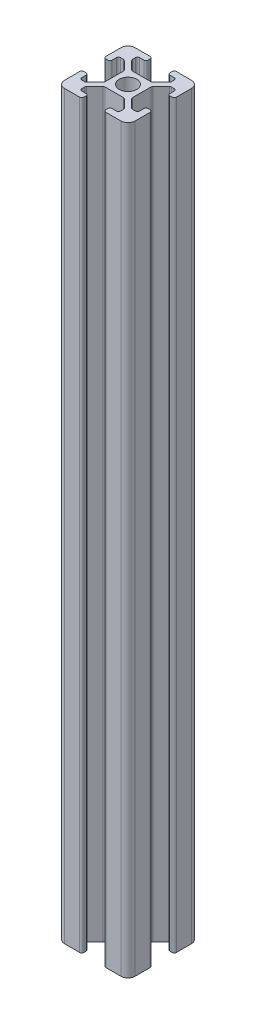
from build123d import *

# Parameters (mm, degrees)
SKETCH_1_R      = 2.5
EXTRUDE_1_DEPTH = 210


with BuildPart() as part:
    # 草图1 → 凸台-拉伸1 (new body)
    with BuildSketch(Plane(origin=(0, 0, 0), x_dir=(1, 0, 0), z_dir=(0, 1, 0))):
        with BuildLine():
            Line((3.1, 8.8), (3.1, 9.4))
            ThreePointArc((3.1, 9.4), (3.275735931, 9.824264069), (3.7, 10))
            Line((3.7, 10), (8, 10))
            ThreePointArc((8, 10), (9.414213562, 9.414213562), (10, 8))
            Line((10, 8), (10, 3.7))
            ThreePointArc((10, 3.7), (9.824264069, 3.275735931), (9.4, 3.1))
            Line((9.4, 3.1), (8.8, 3.1))
            ThreePointArc((8.8, 3.1), (8.375735931, 3.275735931), (8.2, 3.7))
            Line((8.2, 3.7), (8.2, 4.9))
            ThreePointArc((8.2, 4.9), (8.024264069, 5.324264069), (7.6, 5.5))
            Line((7.6, 5.5), (6.809188309, 5.5))
            ThreePointArc((6.809188309, 5.5), (6.57957825, 5.45432772), (6.38492424, 5.324264069))
            Line((6.38492424, 5.324264069), (4.075735931, 3.01507576))
            ThreePointArc((4.075735931, 3.01507576), (3.94567228, 2.82042175), (3.9, 2.590811691))
            Line((3.9, 2.590811691), (3.9, 0))
            Line((3.9, 0), (3.9, -2.590811691))
            ThreePointArc((3.9, -2.590811691), (3.94567228, -2.82042175), (4.075735931, -3.01507576))
            Line((4.075735931, -3.01507576), (6.38492424, -5.324264069))
            ThreePointArc((6.38492424, -5.324264069), (6.57957825, -5.45432772), (6.809188309, -5.5))
            Line((6.809188309, -5.5), (7.6, -5.5))
            ThreePointArc((7.6, -5.5), (8.024264069, -5.324264069), (8.2, -4.9))
            Line((8.2, -4.9), (8.2, -3.7))
            ThreePointArc((8.2, -3.7), (8.375735931, -3.275735931), (8.8, -3.1))
            Line((8.8, -3.1), (9.4, -3.1))
            ThreePointArc((9.4, -3.1), (9.824264069, -3.275735931), (10, -3.7))
            Line((10, -3.7), (10, -8))
            ThreePointArc((10, -8), (9.414213562, -9.414213562), (8, -10))
            Line((8, -10), (3.7, -10))
            ThreePointArc((3.7, -10), (3.275735931, -9.824264069), (3.1, -9.4))
            Line((3.1, -9.4), (3.1, -8.8))
            ThreePointArc((3.1, -8.8), (3.275735931, -8.375735931), (3.7, -8.2))
            Line((3.7, -8.2), (4.9, -8.2))
            ThreePointArc((4.9, -8.2), (5.324264069, -8.024264069), (5.5, -7.6))
            Line((5.5, -7.6), (5.5, -6.809188309))
            ThreePointArc((5.5, -6.809188309), (5.45432772, -6.57957825), (5.324264069, -6.38492424))
            Line((5.324264069, -6.38492424), (3.01507576, -4.075735931))
            ThreePointArc((3.01507576, -4.075735931), (2.82042175, -3.94567228), (2.590811691, -3.9))
            Line((2.590811691, -3.9), (0, -3.9))
            Line((0, -3.9), (-2.590811691, -3.9))
            ThreePointArc((-2.590811691, -3.9), (-2.82042175, -3.94567228), (-3.01507576, -4.075735931))
            Line((-3.01507576, -4.075735931), (-5.324264069, -6.38492424))
            ThreePointArc((-5.324264069, -6.38492424), (-5.45432772, -6.57957825), (-5.5, -6.809188309))
            Line((-5.5, -6.809188309), (-5.5, -7.6))
            ThreePointArc((-5.5, -7.6), (-5.324264069, -8.024264069), (-4.9, -8.2))
            Line((-4.9, -8.2), (-3.7, -8.2))
            ThreePointArc((-3.7, -8.2), (-3.275735931, -8.375735931), (-3.1, -8.8))
            Line((-3.1, -8.8), (-3.1, -9.4))
            ThreePointArc((-3.1, -9.4), (-3.275735931, -9.824264069), (-3.7, -10))
            Line((-3.7, -10), (-8, -10))
            ThreePointArc((-8, -10), (-9.414213562, -9.414213562), (-10, -8))
            Line((-10, -8), (-10, -3.7))
            ThreePointArc((-10, -3.7), (-9.824264069, -3.275735931), (-9.4, -3.1))
            Line((-9.4, -3.1), (-8.8, -3.1))
            ThreePointArc((-8.8, -3.1), (-8.375735931, -3.275735931), (-8.2, -3.7))
            Line((-8.2, -3.7), (-8.2, -4.9))
            ThreePointArc((-8.2, -4.9), (-8.024264069, -5.324264069), (-7.6, -5.5))
            Line((-7.6, -5.5), (-6.809188309, -5.5))
            ThreePointArc((-6.809188309, -5.5), (-6.57957825, -5.45432772), (-6.38492424, -5.324264069))
            Line((-6.38492424, -5.324264069), (-4.075735931, -3.01507576))
            ThreePointArc((-4.075735931, -3.01507576), (-3.94567228, -2.82042175), (-3.9, -2.590811691))
            Line((-3.9, -2.590811691), (-3.9, 0))
            Line((-3.9, 0), (-3.9, 2.590811691))
            ThreePointArc((-3.9, 2.590811691), (-3.94567228, 2.82042175), (-4.075735931, 3.01507576))
            Line((-4.075735931, 3.01507576), (-6.38492424, 5.324264069))
            ThreePointArc((-6.38492424, 5.324264069), (-6.57957825, 5.45432772), (-6.809188309, 5.5))
            Line((-6.809188309, 5.5), (-7.6, 5.5))
            ThreePointArc((-7.6, 5.5), (-8.024264069, 5.324264069), (-8.2, 4.9))
            Line((-8.2, 4.9), (-8.2, 3.7))
            ThreePointArc((-8.2, 3.7), (-8.375735931, 3.275735931), (-8.8, 3.1))
            Line((-8.8, 3.1), (-9.4, 3.1))
            ThreePointArc((-9.4, 3.1), (-9.824264069, 3.275735931), (-10, 3.7))
            Line((-10, 3.7), (-10, 8))
            ThreePointArc((-10, 8), (-9.414213562, 9.414213562), (-8, 10))
            Line((-8, 10), (-3.7, 10))
            ThreePointArc((-3.7, 10), (-3.275735931, 9.824264069), (-3.1, 9.4))
            Line((-3.1, 9.4), (-3.1, 8.8))
            ThreePointArc((-3.1, 8.8), (-3.275735931, 8.375735931), (-3.7, 8.2))
            Line((-3.7, 8.2), (-4.9, 8.2))
            ThreePointArc((-4.9, 8.2), (-5.324264069, 8.024264069), (-5.5, 7.6))
            Line((-5.5, 7.6), (-5.5, 6.809188309))
            ThreePointArc((-5.5, 6.809188309), (-5.45432772, 6.57957825), (-5.324264069, 6.38492424))
            Line((-5.324264069, 6.38492424), (-3.01507576, 4.075735931))
            ThreePointArc((-3.01507576, 4.075735931), (-2.82042175, 3.94567228), (-2.590811691, 3.9))
            Line((-2.590811691, 3.9), (0, 3.9))
            Line((0, 3.9), (2.590811691, 3.9))
            ThreePointArc((2.590811691, 3.9), (2.82042175, 3.94567228), (3.01507576, 4.075735931))
            Line((3.01507576, 4.075735931), (5.324264069, 6.38492424))
            ThreePointArc((5.324264069, 6.38492424), (5.45432772, 6.57957825), (5.5, 6.809188309))
            Line((5.5, 6.809188309), (5.5, 7.6))
            ThreePointArc((5.5, 7.6), (5.324264069, 8.024264069), (4.9, 8.2))
            Line((4.9, 8.2), (3.7, 8.2))
            ThreePointArc((3.7, 8.2), (3.275735931, 8.375735931), (3.1, 8.8))
        make_face()
        Circle(SKETCH_1_R, mode=Mode.SUBTRACT)
    extrude(amount=EXTRUDE_1_DEPTH)


solid = part.part
